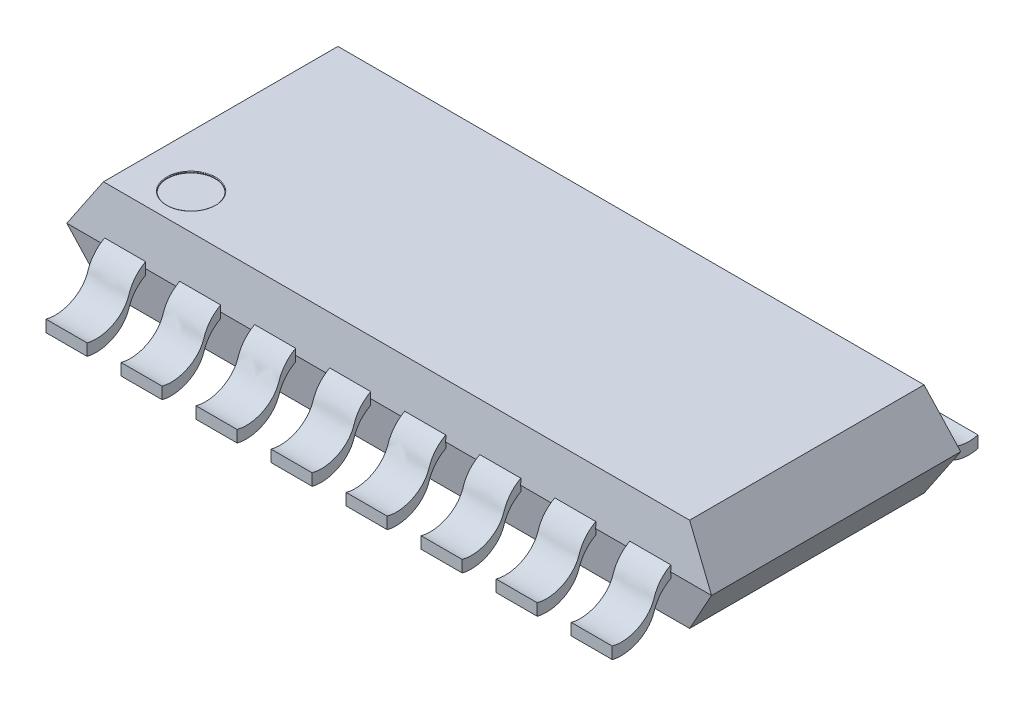
from build123d import *

# Parameters (mm, degrees)
ESQUISSE4_R                = 0.409241739
ENL_V_MAT_EXTRU_1_DEPTH    = 0.02
CONG_1_R                   = 0.01
LISSAGE3_START             = 4.1
LISSAGE3_DEPTH             = 0.7
R_P_TITION_LIN_AIRE1_COUNT = 8
R_P_TITION_LIN_AIRE1_PITCH = 1.28
SYM_TRIE2_START            = 4.1
SYM_TRIE2_COPY_1_DEPTH     = 0.7
SYM_TRIE2_COPY_2_DEPTH     = 0.7
SYM_TRIE2_COPY_3_DEPTH     = 0.7
SYM_TRIE2_COPY_4_DEPTH     = 0.7
SYM_TRIE2_COPY_5_DEPTH     = 0.7
SYM_TRIE2_COPY_6_DEPTH     = 0.7
SYM_TRIE2_COPY_7_DEPTH     = 0.7


# Read off the part's stored shape, not the designer's step: Lissage3
with BuildPart() as part:
    # Esquisse2 → Lissage1 section 0
    with BuildSketch(Plane(origin=(0, -0.8, 0), x_dir=(1, 0, 0), z_dir=(0, 1, 0))):
        with BuildLine():
            Line((5, -2), (-5, -2))
            Line((-5, -2), (-5, 2))
            Line((-5, 2), (5, 2))
            Line((5, 2), (5, -2))
        make_face()
    # Esquisse1 → Lissage1 section 1
    with BuildSketch(Plane(origin=(0, 0, 0), x_dir=(1, 0, 0), z_dir=(0, 1, 0))):
        with BuildLine():
            Line((5.5, -2.125), (-5.5, -2.125))
            Line((-5.5, -2.125), (-5.5, 2.125))
            Line((-5.5, 2.125), (5.5, 2.125))
            Line((5.5, 2.125), (5.5, -2.125))
        make_face()
    lissage1 = loft()

    # Symétrie1: Lissage1 across plane
    add(lissage1.mirror(Plane.ZX))

    # Esquisse4 → Enlèv. mat.-Extru.1 (cut)
    with BuildSketch(Plane(origin=(0, 0.8, 0), x_dir=(1, 0, 0), z_dir=(0, 1, 0))):
        with Locations(Location((-4.113643638, -1.391558976, 0), (0, 0, 270))):
            Circle(ESQUISSE4_R)
    extrude(amount=-ENL_V_MAT_EXTRU_1_DEPTH, mode=Mode.SUBTRACT)

    # Congé1
    cong_1_edges = [part.edges().sort_by_distance(p)[0] for p in [
        (-4.113643638, 0.8, 0.982317237),
    ]]
    fillet(cong_1_edges, radius=CONG_1_R)

    # Lissage3 outline → Lissage3 (add)
    with BuildSketch(Plane.YZ.offset(LISSAGE3_START)):
        with BuildLine():
            Line((-0.6, 3.12), (-0.8, 3.12))
            add(Edge.make_bspline(
                [(-0.8, 3.12), (-0.875598405, 2.838988787), (-0.7295434, 2.492951397), (-0.296940066, 2.359184068), (-0.169955349, 2.250883445), (-0.1, 2.12)],
                knots=[0, 0, 0, 0, 0.642902987, 0.67213191, 1, 1, 1, 1], degree=3))
            Line((-0.1, 2.12), (-0.032, 2.12))
            Line((-0.032, 2.12), (0, 2.125))
            Line((0, 2.125), (0.032, 2.12))
            Line((0.032, 2.12), (0.1, 2.12))
            add(Edge.make_bspline(
                [(-0.6, 3.12), (-0.675598405, 2.838988787), (-0.5295434, 2.492951397), (-0.096940066, 2.359184068), (0.030044651, 2.250883445), (0.1, 2.12)],
                knots=[0, 0, 0, 0, 0.642902987, 0.67213191, 1, 1, 1, 1], degree=3))
        make_face()
    lissage3 = extrude(amount=LISSAGE3_DEPTH)

    # Répétition linéaire1: Lissage3 ×8
    with Locations(*[(-i * R_P_TITION_LIN_AIRE1_PITCH, 0, 0) for i in range(1, R_P_TITION_LIN_AIRE1_COUNT)]):
        add(lissage3)

    # Symétrie2: Lissage3 across plane
    add(lissage3.mirror(Plane.XY))

    # Symétrie2 copy 1 sketch → Symétrie2 copy 1 (add)
    with BuildSketch(Plane.YZ.offset(-1.28).offset(SYM_TRIE2_START)):
        with BuildLine():
            Line((-0.6, -3.12), (-0.8, -3.12))
            add(Edge.make_bspline(
                [(-0.8, -3.12), (-0.875598405, -2.838988787), (-0.7295434, -2.492951397), (-0.296940066, -2.359184068), (-0.169955349, -2.250883445), (-0.1, -2.12)],
                knots=[0, 0, 0, 0, 0.642902987, 0.67213191, 1, 1, 1, 1], degree=3))
            Line((-0.1, -2.12), (-0.032, -2.12))
            Line((-0.032, -2.12), (0, -2.125))
            Line((0, -2.125), (0.032, -2.12))
            Line((0.032, -2.12), (0.1, -2.12))
            add(Edge.make_bspline(
                [(-0.6, -3.12), (-0.675598405, -2.838988787), (-0.5295434, -2.492951397), (-0.096940066, -2.359184068), (0.030044651, -2.250883445), (0.1, -2.12)],
                knots=[0, 0, 0, 0, 0.642902987, 0.67213191, 1, 1, 1, 1], degree=3))
        make_face()
    extrude(amount=SYM_TRIE2_COPY_1_DEPTH)

    # Symétrie2 copy 2 sketch → Symétrie2 copy 2 (add)
    with BuildSketch(Plane.YZ.offset(-2.56).offset(SYM_TRIE2_START)):
        with BuildLine():
            Line((-0.6, -3.12), (-0.8, -3.12))
            add(Edge.make_bspline(
                [(-0.8, -3.12), (-0.875598405, -2.838988787), (-0.7295434, -2.492951397), (-0.296940066, -2.359184068), (-0.169955349, -2.250883445), (-0.1, -2.12)],
                knots=[0, 0, 0, 0, 0.642902987, 0.67213191, 1, 1, 1, 1], degree=3))
            Line((-0.1, -2.12), (-0.032, -2.12))
            Line((-0.032, -2.12), (0, -2.125))
            Line((0, -2.125), (0.032, -2.12))
            Line((0.032, -2.12), (0.1, -2.12))
            add(Edge.make_bspline(
                [(-0.6, -3.12), (-0.675598405, -2.838988787), (-0.5295434, -2.492951397), (-0.096940066, -2.359184068), (0.030044651, -2.250883445), (0.1, -2.12)],
                knots=[0, 0, 0, 0, 0.642902987, 0.67213191, 1, 1, 1, 1], degree=3))
        make_face()
    extrude(amount=SYM_TRIE2_COPY_2_DEPTH)

    # Symétrie2 copy 3 sketch → Symétrie2 copy 3 (add)
    with BuildSketch(Plane.YZ.offset(-3.84).offset(SYM_TRIE2_START)):
        with BuildLine():
            Line((-0.6, -3.12), (-0.8, -3.12))
            add(Edge.make_bspline(
                [(-0.8, -3.12), (-0.875598405, -2.838988787), (-0.7295434, -2.492951397), (-0.296940066, -2.359184068), (-0.169955349, -2.250883445), (-0.1, -2.12)],
                knots=[0, 0, 0, 0, 0.642902987, 0.67213191, 1, 1, 1, 1], degree=3))
            Line((-0.1, -2.12), (-0.032, -2.12))
            Line((-0.032, -2.12), (0, -2.125))
            Line((0, -2.125), (0.032, -2.12))
            Line((0.032, -2.12), (0.1, -2.12))
            add(Edge.make_bspline(
                [(-0.6, -3.12), (-0.675598405, -2.838988787), (-0.5295434, -2.492951397), (-0.096940066, -2.359184068), (0.030044651, -2.250883445), (0.1, -2.12)],
                knots=[0, 0, 0, 0, 0.642902987, 0.67213191, 1, 1, 1, 1], degree=3))
        make_face()
    extrude(amount=SYM_TRIE2_COPY_3_DEPTH)

    # Symétrie2 copy 4 sketch → Symétrie2 copy 4 (add)
    with BuildSketch(Plane.YZ.offset(-5.12).offset(SYM_TRIE2_START)):
        with BuildLine():
            Line((-0.6, -3.12), (-0.8, -3.12))
            add(Edge.make_bspline(
                [(-0.8, -3.12), (-0.875598405, -2.838988787), (-0.7295434, -2.492951397), (-0.296940066, -2.359184068), (-0.169955349, -2.250883445), (-0.1, -2.12)],
                knots=[0, 0, 0, 0, 0.642902987, 0.67213191, 1, 1, 1, 1], degree=3))
            Line((-0.1, -2.12), (-0.032, -2.12))
            Line((-0.032, -2.12), (0, -2.125))
            Line((0, -2.125), (0.032, -2.12))
            Line((0.032, -2.12), (0.1, -2.12))
            add(Edge.make_bspline(
                [(-0.6, -3.12), (-0.675598405, -2.838988787), (-0.5295434, -2.492951397), (-0.096940066, -2.359184068), (0.030044651, -2.250883445), (0.1, -2.12)],
                knots=[0, 0, 0, 0, 0.642902987, 0.67213191, 1, 1, 1, 1], degree=3))
        make_face()
    extrude(amount=SYM_TRIE2_COPY_4_DEPTH)

    # Symétrie2 copy 5 sketch → Symétrie2 copy 5 (add)
    with BuildSketch(Plane.YZ.offset(-6.4).offset(SYM_TRIE2_START)):
        with BuildLine():
            Line((-0.6, -3.12), (-0.8, -3.12))
            add(Edge.make_bspline(
                [(-0.8, -3.12), (-0.875598405, -2.838988787), (-0.7295434, -2.492951397), (-0.296940066, -2.359184068), (-0.169955349, -2.250883445), (-0.1, -2.12)],
                knots=[0, 0, 0, 0, 0.642902987, 0.67213191, 1, 1, 1, 1], degree=3))
            Line((-0.1, -2.12), (-0.032, -2.12))
            Line((-0.032, -2.12), (0, -2.125))
            Line((0, -2.125), (0.032, -2.12))
            Line((0.032, -2.12), (0.1, -2.12))
            add(Edge.make_bspline(
                [(-0.6, -3.12), (-0.675598405, -2.838988787), (-0.5295434, -2.492951397), (-0.096940066, -2.359184068), (0.030044651, -2.250883445), (0.1, -2.12)],
                knots=[0, 0, 0, 0, 0.642902987, 0.67213191, 1, 1, 1, 1], degree=3))
        make_face()
    extrude(amount=SYM_TRIE2_COPY_5_DEPTH)

    # Symétrie2 copy 6 sketch → Symétrie2 copy 6 (add)
    with BuildSketch(Plane.YZ.offset(-7.68).offset(SYM_TRIE2_START)):
        with BuildLine():
            Line((-0.6, -3.12), (-0.8, -3.12))
            add(Edge.make_bspline(
                [(-0.8, -3.12), (-0.875598405, -2.838988787), (-0.7295434, -2.492951397), (-0.296940066, -2.359184068), (-0.169955349, -2.250883445), (-0.1, -2.12)],
                knots=[0, 0, 0, 0, 0.642902987, 0.67213191, 1, 1, 1, 1], degree=3))
            Line((-0.1, -2.12), (-0.032, -2.12))
            Line((-0.032, -2.12), (0, -2.125))
            Line((0, -2.125), (0.032, -2.12))
            Line((0.032, -2.12), (0.1, -2.12))
            add(Edge.make_bspline(
                [(-0.6, -3.12), (-0.675598405, -2.838988787), (-0.5295434, -2.492951397), (-0.096940066, -2.359184068), (0.030044651, -2.250883445), (0.1, -2.12)],
                knots=[0, 0, 0, 0, 0.642902987, 0.67213191, 1, 1, 1, 1], degree=3))
        make_face()
    extrude(amount=SYM_TRIE2_COPY_6_DEPTH)

    # Symétrie2 copy 7 sketch → Symétrie2 copy 7 (add)
    with BuildSketch(Plane.YZ.offset(-8.96).offset(SYM_TRIE2_START)):
        with BuildLine():
            Line((-0.6, -3.12), (-0.8, -3.12))
            add(Edge.make_bspline(
                [(-0.8, -3.12), (-0.875598405, -2.838988787), (-0.7295434, -2.492951397), (-0.296940066, -2.359184068), (-0.169955349, -2.250883445), (-0.1, -2.12)],
                knots=[0, 0, 0, 0, 0.642902987, 0.67213191, 1, 1, 1, 1], degree=3))
            Line((-0.1, -2.12), (-0.032, -2.12))
            Line((-0.032, -2.12), (0, -2.125))
            Line((0, -2.125), (0.032, -2.12))
            Line((0.032, -2.12), (0.1, -2.12))
            add(Edge.make_bspline(
                [(-0.6, -3.12), (-0.675598405, -2.838988787), (-0.5295434, -2.492951397), (-0.096940066, -2.359184068), (0.030044651, -2.250883445), (0.1, -2.12)],
                knots=[0, 0, 0, 0, 0.642902987, 0.67213191, 1, 1, 1, 1], degree=3))
        make_face()
    extrude(amount=SYM_TRIE2_COPY_7_DEPTH)


solid = part.part
